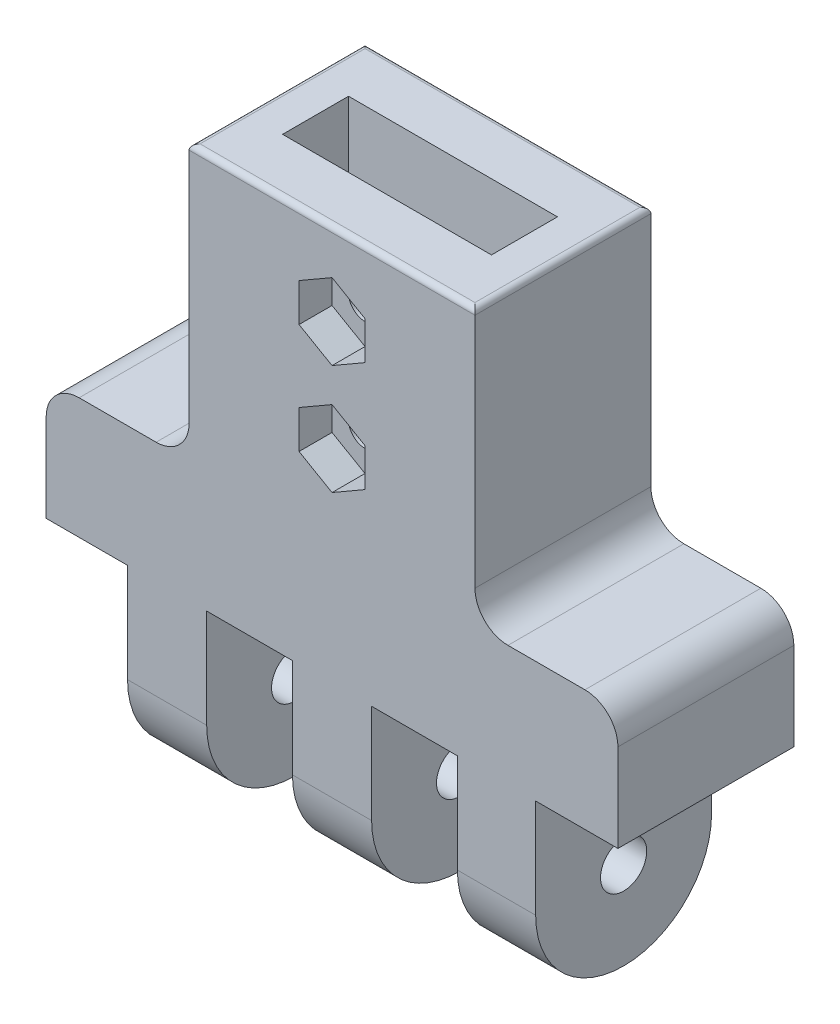
from build123d import *

# Parameters (mm, degrees)
SKETCH2_R           = 2.1
BOSS_EXTRUDE1_DEPTH = 26
SKETCH3_W           = 7.4
SKETCH3_H           = 18
SKETCH3_W_2         = 7.8
SKETCH3_W_3         = 7.481047655
CUT_EXTRUDE1_DEPTH  = 37.496575182
SKETCH4_W           = 26
SKETCH4_H           = 16
BOSS_EXTRUDE2_DEPTH = 25
SKETCH5_W           = 19
SKETCH5_H           = 6
CUT_EXTRUDE2_DEPTH  = 25
FILLET2_R           = 3
SKETCH6_R           = 1.5
CUT_EXTRUDE3_DEPTH  = 12.5
FILLET3_R           = 0.5
FILLET4_R           = 3
CUT_EXTRUDE4_DEPTH  = 3


with BuildPart() as part:
    # Sketch2 → Boss-Extrude1 (new, symmetric)
    with BuildSketch(Plane(origin=(0, 0, 0), x_dir=(0, 0, -1), z_dir=(1, 0, 0))):
        with BuildLine():
            Line((-8, 0), (-8, 20))
            Line((-8, 20), (8, 20))
            Line((8, 20), (8, 0))
            ThreePointArc((8, 0), (0, -8), (-8, 0))
        make_face()
        Circle(SKETCH2_R, mode=Mode.SUBTRACT)
    extrude(amount=BOSS_EXTRUDE1_DEPTH, both=True)

    # Sketch3 → Cut-Extrude1 (cut, through all)
    with BuildSketch(Plane.XY.offset(8)):
        with Locations((-22.3, 0)):
            Rectangle(SKETCH3_W, SKETCH3_H)
        with Locations((-7.5, 0)):
            Rectangle(SKETCH3_W_2, SKETCH3_H)
        with Locations((7.5, 0)):
            Rectangle(SKETCH3_W_2, SKETCH3_H)
        with Locations((22.259476173, 0)):
            Rectangle(SKETCH3_W_3, SKETCH3_H)
    extrude(amount=-CUT_EXTRUDE1_DEPTH, mode=Mode.SUBTRACT)

    # Sketch4 → Boss-Extrude2 (add)
    with BuildSketch(Plane(origin=(0, 20, 0), x_dir=(1, 0, 0), z_dir=(0, 1, 0))):
        Rectangle(SKETCH4_W, SKETCH4_H)
    extrude(amount=BOSS_EXTRUDE2_DEPTH)

    # Sketch5 → Cut-Extrude2 (cut)
    with BuildSketch(Plane(origin=(0, 45, 0), x_dir=(1, 0, 0), z_dir=(0, 1, 0))):
        Rectangle(SKETCH5_W, SKETCH5_H)
    extrude(amount=-CUT_EXTRUDE2_DEPTH, mode=Mode.SUBTRACT)

    # Fillet2
    fillet2_edges = [part.edges().sort_by_distance(p)[0] for p in [
        (26, 20, 0),
        (-26, 20, 0),
    ]]
    fillet(fillet2_edges, radius=FILLET2_R)

    # Sketch6 → Cut-Extrude3 (cut, symmetric)
    with BuildSketch(Plane.XY):
        with Locations((0, 37.5)):
            Circle(SKETCH6_R)
        with Locations((0, 27.5)):
            Circle(SKETCH6_R)
    extrude(amount=CUT_EXTRUDE3_DEPTH, both=True, mode=Mode.SUBTRACT)

    # Fillet3
    fillet3_edges = [part.edges().sort_by_distance(p)[0] for p in [
        (0, 45, 8),
        (13, 45, 0),
        (0, 45, -8),
        (-13, 45, 0),
    ]]
    fillet(fillet3_edges, radius=FILLET3_R)

    # Fillet4
    fillet4_edges = [part.edges().sort_by_distance(p)[0] for p in [
        (13, 20, 0),
        (-13, 20, 0),
    ]]
    fillet(fillet4_edges, radius=FILLET4_R)

    # Sketch7 → Cut-Extrude4 (cut)
    with BuildSketch(Plane.XY.offset(8)):
        Polygon((3, 35.767949192), (3, 39.232050808), (0, 40.964101615), (-3, 39.232050808), (-3, 35.767949192), (0, 34.035898385), align=None)
        Polygon((3, 25.767949192), (3, 29.232050808), (0, 30.964101615), (-3, 29.232050808), (-3, 25.767949192), (0, 24.035898385), align=None)
    extrude(amount=-CUT_EXTRUDE4_DEPTH, mode=Mode.SUBTRACT)


solid = part.part
